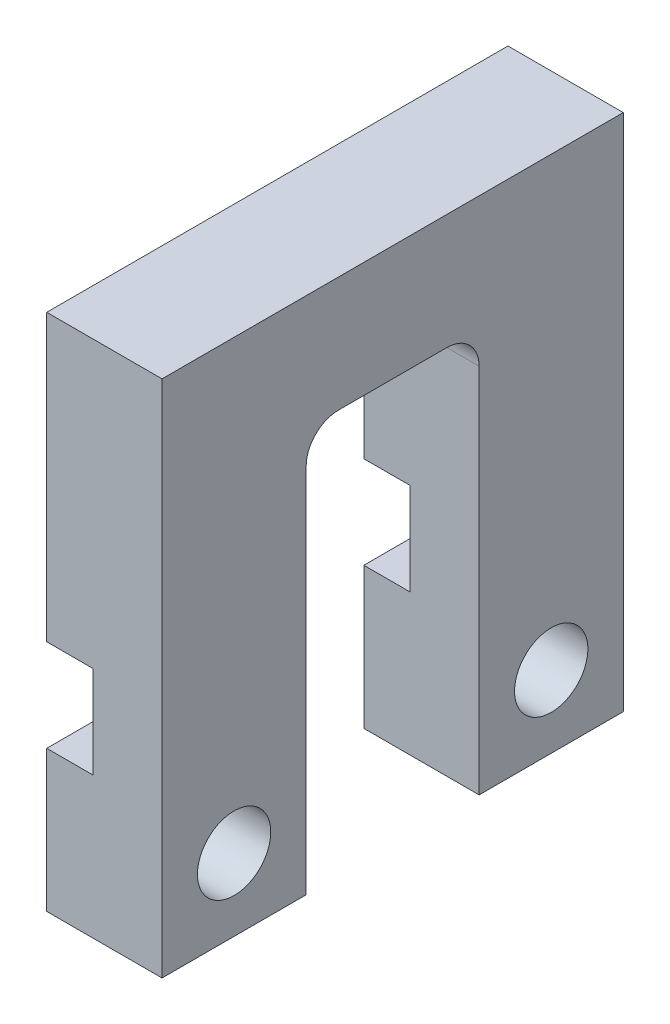
from build123d import *

# Parameters (mm, degrees)
BOSS_EXTRUDE1_DEPTH    = 6.35
F_10_32_TAPPED_HOLE1_D = 4.0386
SKETCH2_W              = 25.4
SKETCH2_H              = 5.08
CUT_EXTRUDE1_DEPTH     = 2.54


with BuildPart() as part:
    # Sketch1 → Boss-Extrude1 (new body)
    with BuildSketch(Plane(origin=(0, 0, 0), x_dir=(0, 0, -1), z_dir=(1, 0, 0))):
        with BuildLine():
            Line((7.9375, 0), (7.9375, 20.447))
            ThreePointArc((7.9375, 20.447), (8.458264143, 21.704235857), (9.7155, 22.225))
            Line((9.7155, 22.225), (15.6845, 22.225))
            ThreePointArc((15.6845, 22.225), (16.941735857, 21.704235857), (17.4625, 20.447))
            Line((17.4625, 20.447), (17.4625, 0))
            Line((17.4625, 0), (25.4, 0))
            Line((25.4, 0), (25.4, 28.575))
            Line((25.4, 28.575), (0, 28.575))
            Line((0, 28.575), (0, 0))
            Line((0, 0), (7.9375, 0))
        make_face()
    extrude(amount=BOSS_EXTRUDE1_DEPTH)

    # #10-32 Tapped Hole1 (through all)
    with Locations(Plane.ZY):
        with Locations((-21.43125, 3.96875), (-3.96875, 3.96875)):
            Hole(F_10_32_TAPPED_HOLE1_D / 2)

    # Sketch2 → Cut-Extrude1 (cut)
    with BuildSketch(Plane.ZY):
        with Locations((-12.7, 10.31875)):
            Rectangle(SKETCH2_W, SKETCH2_H)
    extrude(amount=-CUT_EXTRUDE1_DEPTH, mode=Mode.SUBTRACT)


solid = part.part
